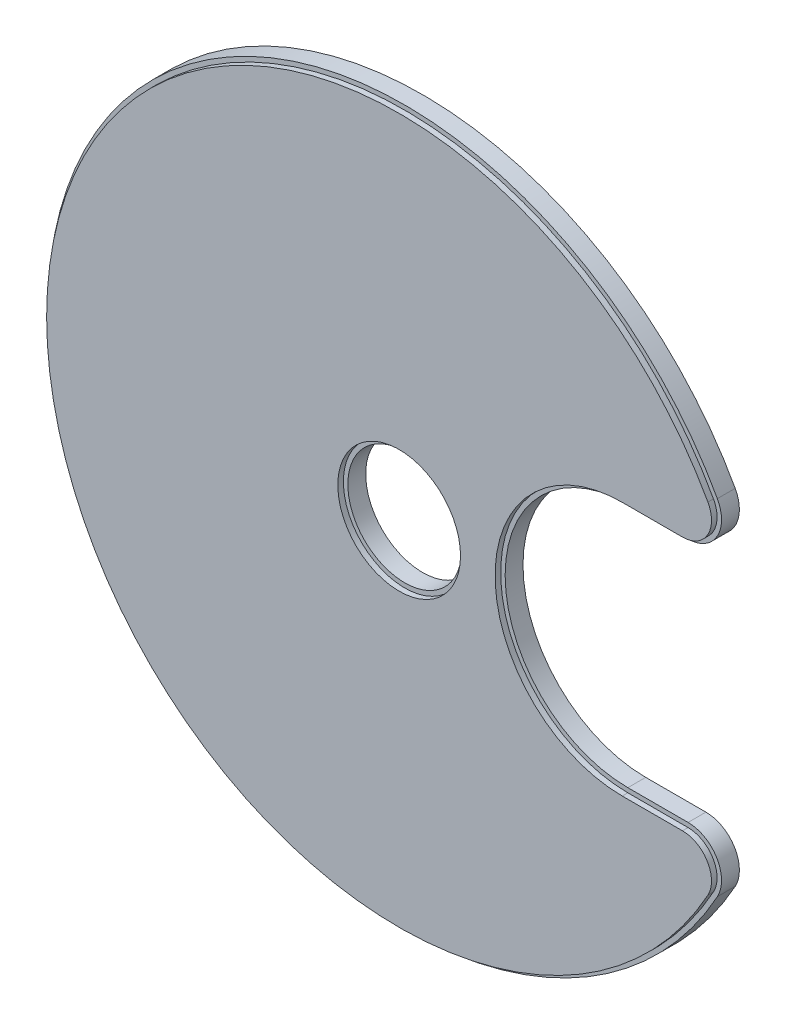
from build123d import *

# Parameters (mm, degrees)
ESQUISSE1_R        = 5.1
BOSS_EXTRU_1_DEPTH = 1.6
CONG_1_R           = 3
ESQUISSE2_R        = 5.5
BOSS_EXTRU_2_DEPTH = 0.5


with BuildPart() as part:
    # Esquisse1 → Boss.-Extru.1 (new body)
    with BuildSketch(Plane.XY):
        with BuildLine():
            Line((30.049958403, 11), (20, 11))
            ThreePointArc((20, 11), (9, 0), (20, -11))
            Line((20, -11), (30.049958403, -11))
            ThreePointArc((30.049958403, -11), (-32, 0), (30.049958403, 11))
        make_face()
        Circle(ESQUISSE1_R, mode=Mode.SUBTRACT)
    extrude(amount=BOSS_EXTRU_1_DEPTH)

    # Congé1
    cong_1_edges = [part.edges().sort_by_distance(p)[0] for p in [
        (30.049958403, -11, 0.8),
        (30.049958403, 11, 0.8),
    ]]
    fillet(cong_1_edges, radius=CONG_1_R)

    # Esquisse2 → Boss.-Extru.2 (add)
    with BuildSketch(Plane.XY.offset(1.6)):
        with BuildLine():
            Line((25.396850198, -11.4), (20, -11.4))
            ThreePointArc((20, -11.4), (8.6, 0), (20, 11.4))
            Line((20, 11.4), (25.396850198, 11.4))
            ThreePointArc((25.396850198, 11.4), (27.635538238, 12.677776168), (27.673809182, 15.255172414))
            ThreePointArc((27.673809182, 15.255172414), (-31.6, 0), (27.673809182, -15.255172414))
            ThreePointArc((27.673809182, -15.255172414), (27.635538238, -12.677776168), (25.396850198, -11.4))
        make_face()
        Circle(ESQUISSE2_R, mode=Mode.SUBTRACT)
    extrude(amount=BOSS_EXTRU_2_DEPTH)


solid = part.part
